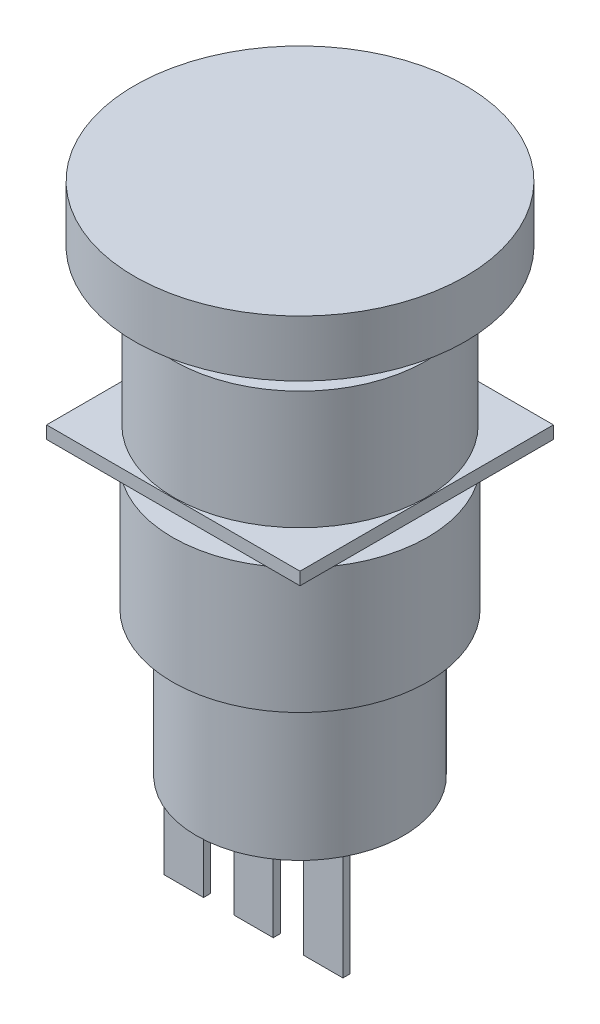
from build123d import *

# Parameters (mm, degrees)
ESBO_O2_W                = 18
ESBO_O2_H                = 18
RESSALTO_EXTRUS_O1_DEPTH = 0.9
RESSALTO_EXTRUS_O2_START = 2.8
ESBO_O4_W                = 2.8
ESBO_O4_H                = 7.6
RESSALTO_EXTRUS_O2_DEPTH = 0.5
ESBO_O5_W                = 1.6
ESBO_O5_H                = 8.9


with BuildPart() as part:
    # Esboço1 → Revolução1 (revolve)
    with BuildSketch(Plane.XY):
        Polygon((0, 0), (-8.95, 0), (-8.95, -8.4), (-7.35, -8.4), (-7.35, -30), (0, -30), align=None)
    revolve(axis=Axis((0, 0, 0), (0, -1, 0)))

    # Esboço2 → Ressalto-extrusão1 (add)
    with BuildSketch(Plane.XZ.offset(8.4)):
        Rectangle(ESBO_O2_W, ESBO_O2_H)
    extrude(amount=RESSALTO_EXTRUS_O1_DEPTH)

    # Esboço3 → Revolução2 (revolve)
    with BuildSketch(Plane.XY):
        Polygon((-11.75, 6.6), (-11.75, 2.6), (-7.8, 2.6), (-7.8, -3.8), (0, -3.8), (0, 6.6), align=None)
    revolve(axis=Axis((0, -3.8, 0), (0, 1, 0)))

    # Esboço4 → Ressalto-extrusão2 (add)
    with BuildSketch(Plane.XY.offset(RESSALTO_EXTRUS_O2_START)):
        with Locations((-4.95, -33.8)):
            Rectangle(ESBO_O4_W, ESBO_O4_H)
        with Locations((0, -33.8)):
            Rectangle(ESBO_O4_W, ESBO_O4_H)
        with Locations((4.95, -33.8)):
            Rectangle(ESBO_O4_W, ESBO_O4_H)
    extrude(amount=RESSALTO_EXTRUS_O2_DEPTH)


with BuildPart() as body_2:
    # Esboço5 → Revolução3 (revolve)
    with BuildSketch(Plane.XY):
        with Locations((-8.25, -15.25)):
            Rectangle(ESBO_O5_W, ESBO_O5_H)
    revolve(axis=Axis((0, 0, 0), (0, -1, 0)))


solid = Compound([part.part, body_2.part])
